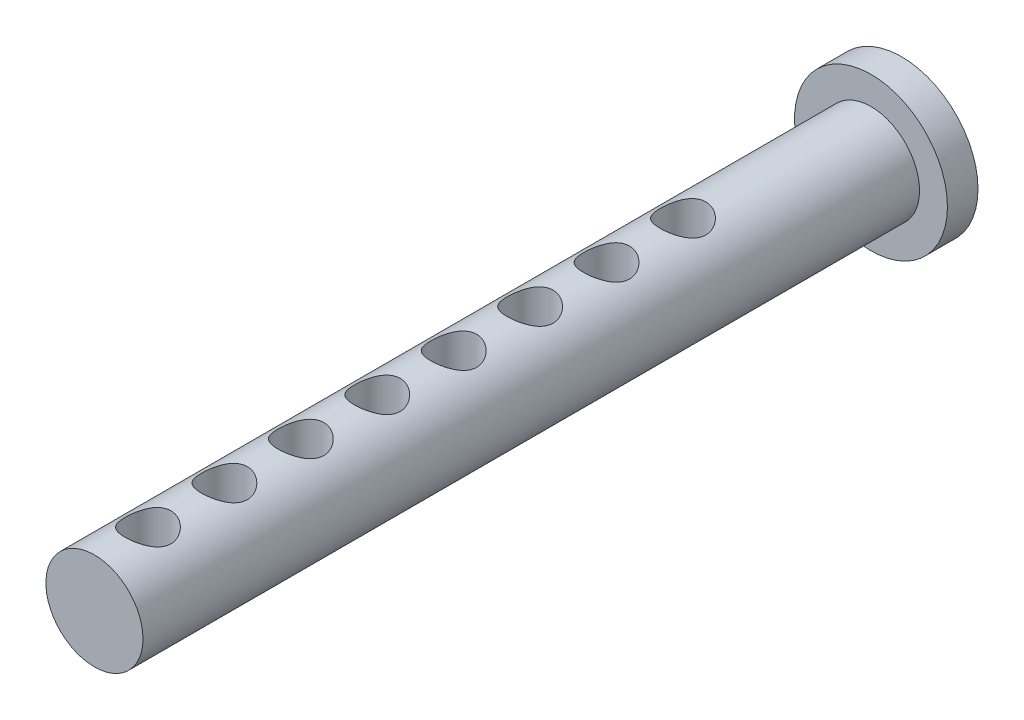
from build123d import *

# Parameters (mm, degrees)
SKETCH1_R               = 5
BOSS_EXTRUDE1_DEPTH     = 2
SKETCH2_R               = 3.175
BOSS_EXTRUDE2_DEPTH     = 50.8
CUT_EXTRUDE1_DEPTH      = 54.271380684
CUT_EXTRUDE1_DEPTH_BACK = 54.271380684
SKETCH3_R               = 1.5


with BuildPart() as part:
    # Sketch1 → Boss-Extrude1 (new body)
    with BuildSketch(Plane.XY):
        Circle(SKETCH1_R)
    extrude(amount=BOSS_EXTRUDE1_DEPTH)

    # Sketch2 → Boss-Extrude2 (add)
    with BuildSketch(Plane.XY.offset(2)):
        Circle(SKETCH2_R)
    extrude(amount=BOSS_EXTRUDE2_DEPTH)

    # Sketch3 → Cut-Extrude1 (cut, two sides: drawn at the far end of the back side and taken through both)
    with BuildSketch(Plane(origin=(0, 0, 0), x_dir=(1, 0, 0), z_dir=(0, 1, 0)).offset(-CUT_EXTRUDE1_DEPTH_BACK)):
        with Locations((0, -49.3)):
            Circle(SKETCH3_R)
        with Locations((0, -44.3)):
            Circle(SKETCH3_R)
        with Locations((0, -39.3)):
            Circle(SKETCH3_R)
        with Locations((0, -34.3)):
            Circle(SKETCH3_R)
        with Locations((0, -29.3)):
            Circle(SKETCH3_R)
        with Locations((0, -24.3)):
            Circle(SKETCH3_R)
        with Locations((0, -19.3)):
            Circle(SKETCH3_R)
        with Locations((0, -14.3)):
            Circle(SKETCH3_R)
    extrude(amount=CUT_EXTRUDE1_DEPTH + CUT_EXTRUDE1_DEPTH_BACK, mode=Mode.SUBTRACT)


solid = part.part
